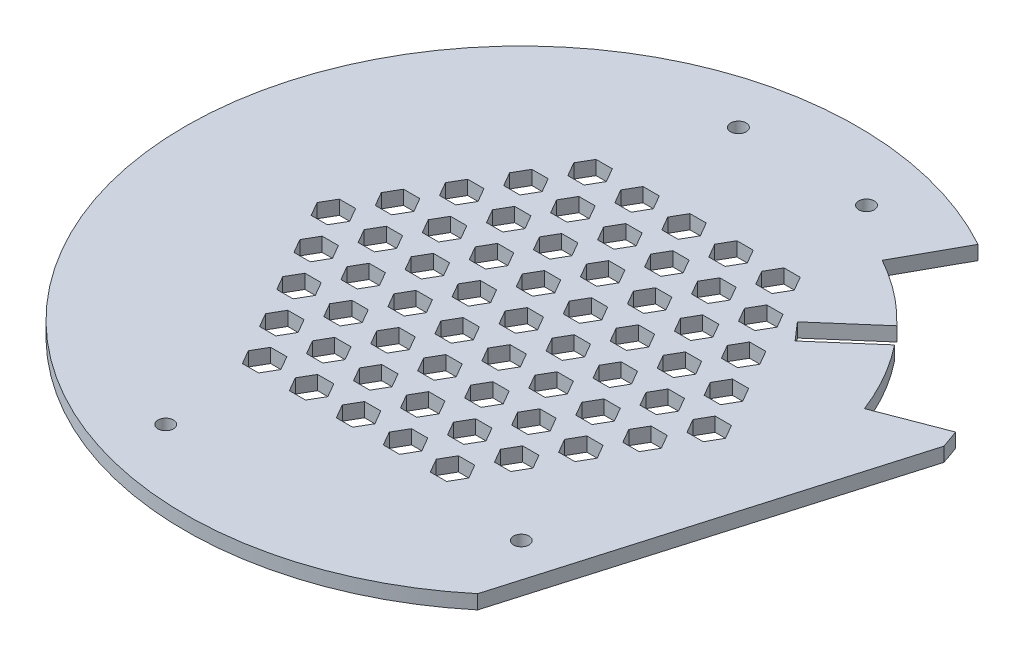
from build123d import *

# Parameters (mm, degrees)
BOSS_EXTRUDE1_DEPTH = 3
BOSS_EXTRUDE3_DEPTH = 3
CUT_EXTRUDE5_DEPTH  = 10
FILL_PATTERN1_DEPTH = 3
CUT_EXTRUDE6_DEPTH  = 102.224374782
SKETCH11_R          = 1.65
CUT_EXTRUDE7_DEPTH  = 102.224374782


# Read off the part's stored shape, not the designer's step: Fill Pattern1
with BuildPart() as part:
    # Sketch1 → Boss-Extrude1 (new body)
    with BuildSketch(Plane(origin=(0, 0, 0), x_dir=(1, 0, 0), z_dir=(0, 1, 0))):
        with BuildLine():
            Line((45.736375855, -55.017005995), (68.149505263, 21.779163377))
            ThreePointArc((68.149505263, 21.779163377), (67.498860282, 23.71899841), (66.793011614, 25.63943495))
            Line((66.793011614, 25.63943495), (46.254242231, 17.75534006))
            ThreePointArc((46.254242231, 17.75534006), (37.366545691, 32.533802239), (23.95179566, 43.370710274))
            Line((23.95179566, 43.370710274), (34.587369472, 62.629073903))
            ThreePointArc((34.587369472, 62.629073903), (-71.225880442, -6.749887428), (45.736375855, -55.017005995))
        make_face()
    extrude(amount=BOSS_EXTRUDE1_DEPTH)

    # Sketch6 → Boss-Extrude3 (add)
    with BuildSketch(Plane(origin=(0, 0, 0), x_dir=(1, 0, 0), z_dir=(0, 1, 0))):
        with BuildLine():
            ThreePointArc((23.95179566, 43.370710274), (30.151710821, 39.31388253), (35.67731642, 34.377843418))
            Line((35.67731642, 34.377843418), (40.95667498, 38.974404436))
            ThreePointArc((40.95667498, 38.974404436), (34.546931444, 44.754474127), (27.332064421, 49.491531408))
            Line((27.332064421, 49.491531408), (23.95179566, 43.370710274))
        make_face()
        with BuildLine():
            Line((46.254242231, 17.75534006), (52.782010432, 20.261115502))
            ThreePointArc((52.782010432, 20.261115502), (49.082915463, 28.059237984), (44.23993285, 35.203434037))
            Line((44.23993285, 35.203434037), (38.960574291, 30.606873018))
            ThreePointArc((38.960574291, 30.606873018), (43.08922967, 24.454556047), (46.254242231, 17.75534006))
        make_face()
    extrude(amount=BOSS_EXTRUDE3_DEPTH)

    # Sketch8 → Cut-Extrude5 (cut)
    with BuildSketch(Plane(origin=(0, 0, 0), x_dir=(1, 0, 0), z_dir=(0, 1, 0))):
        Polygon((-1.732050808, -3), (1.732050808, -3), (3.464101615, 0), (1.732050808, 3), (-1.732050808, 3), (-3.464101615, 0), align=None)
    extrude(amount=CUT_EXTRUDE5_DEPTH, mode=Mode.SUBTRACT)

    # Fill Pattern1 outline → Fill Pattern1 (cut)
    with BuildSketch(Plane(origin=(0, 0, 0), x_dir=(1, 0, 0), z_dir=(0, 1, 0))):
        Polygon((18.267949192, -3), (21.732050808, -3), (23.464101615, 0), (21.732050808, 3), (18.267949192, 3), (16.535898385, 0), align=None)
        Polygon((8.267949192, -3), (11.732050808, -3), (13.464101615, 0), (11.732050808, 3), (8.267949192, 3), (6.535898385, 0), align=None)
        Polygon((28.267949192, -3), (31.732050808, -3), (33.464101615, 0), (31.732050808, 3), (28.267949192, 3), (26.535898385, 0), align=None)
        Polygon((38.267949192, -3), (41.732050808, -3), (43.464101615, 0), (41.732050808, 3), (38.267949192, 3), (36.535898385, 0), align=None)
        Polygon((-31.732050808, -3), (-28.267949192, -3), (-26.535898385, 0), (-28.267949192, 3), (-31.732050808, 3), (-33.464101615, 0), align=None)
        Polygon((-21.732050808, -3), (-18.267949192, -3), (-16.535898385, 0), (-18.267949192, 3), (-21.732050808, 3), (-23.464101615, 0), align=None)
        Polygon((-41.732050808, -3), (-38.267949192, -3), (-36.535898385, 0), (-38.267949192, 3), (-41.732050808, 3), (-43.464101615, 0), align=None)
        Polygon((-11.732050808, -3), (-8.267949192, -3), (-6.535898385, 0), (-8.267949192, 3), (-11.732050808, 3), (-13.464101615, 0), align=None)
        Polygon((-18.267949192, -37.641016151), (-16.535898385, -34.641016151), (-18.267949192, -31.641016151), (-21.732050808, -31.641016151), (-23.464101615, -34.641016151), (-21.732050808, -37.641016151), align=None)
        Polygon((11.732050808, 14.320508076), (13.464101615, 17.320508076), (11.732050808, 20.320508076), (8.267949192, 20.320508076), (6.535898385, 17.320508076), (8.267949192, 14.320508076), align=None)
        Polygon((16.732050808, 22.980762114), (18.464101615, 25.980762114), (16.732050808, 28.980762114), (13.267949192, 28.980762114), (11.535898385, 25.980762114), (13.267949192, 22.980762114), align=None)
        Polygon((21.732050808, 31.641016151), (23.464101615, 34.641016151), (21.732050808, 37.641016151), (18.267949192, 37.641016151), (16.535898385, 34.641016151), (18.267949192, 31.641016151), align=None)
        Polygon((6.732050808, 5.660254038), (8.464101615, 8.660254038), (6.732050808, 11.660254038), (3.267949192, 11.660254038), (1.535898385, 8.660254038), (3.267949192, 5.660254038), align=None)
        Polygon((-3.267949192, -11.660254038), (-1.535898385, -8.660254038), (-3.267949192, -5.660254038), (-6.732050808, -5.660254038), (-8.464101615, -8.660254038), (-6.732050808, -11.660254038), align=None)
        Polygon((-8.267949192, -20.320508076), (-6.535898385, -17.320508076), (-8.267949192, -14.320508076), (-11.732050808, -14.320508076), (-13.464101615, -17.320508076), (-11.732050808, -20.320508076), align=None)
        Polygon((-13.267949192, -28.980762114), (-11.535898385, -25.980762114), (-13.267949192, -22.980762114), (-16.732050808, -22.980762114), (-18.464101615, -25.980762114), (-16.732050808, -28.980762114), align=None)
        Polygon((-16.535898385, 34.641016151), (-18.267949192, 37.641016151), (-21.732050808, 37.641016151), (-23.464101615, 34.641016151), (-21.732050808, 31.641016151), (-18.267949192, 31.641016151), align=None)
        Polygon((13.464101615, -17.320508076), (11.732050808, -14.320508076), (8.267949192, -14.320508076), (6.535898385, -17.320508076), (8.267949192, -20.320508076), (11.732050808, -20.320508076), align=None)
        Polygon((8.464101615, -8.660254038), (6.732050808, -5.660254038), (3.267949192, -5.660254038), (1.535898385, -8.660254038), (3.267949192, -11.660254038), (6.732050808, -11.660254038), align=None)
        Polygon((23.464101615, -34.641016151), (21.732050808, -31.641016151), (18.267949192, -31.641016151), (16.535898385, -34.641016151), (18.267949192, -37.641016151), (21.732050808, -37.641016151), align=None)
        Polygon((18.464101615, -25.980762114), (16.732050808, -22.980762114), (13.267949192, -22.980762114), (11.535898385, -25.980762114), (13.267949192, -28.980762114), (16.732050808, -28.980762114), align=None)
        Polygon((-6.535898385, 17.320508076), (-8.267949192, 20.320508076), (-11.732050808, 20.320508076), (-13.464101615, 17.320508076), (-11.732050808, 14.320508076), (-8.267949192, 14.320508076), align=None)
        Polygon((-11.535898385, 25.980762114), (-13.267949192, 28.980762114), (-16.732050808, 28.980762114), (-18.464101615, 25.980762114), (-16.732050808, 22.980762114), (-13.267949192, 22.980762114), align=None)
        Polygon((-1.535898385, 8.660254038), (-3.267949192, 11.660254038), (-6.732050808, 11.660254038), (-8.464101615, 8.660254038), (-6.732050808, 5.660254038), (-3.267949192, 5.660254038), align=None)
        Polygon((-1.732050808, 31.641016151), (1.732050808, 31.641016151), (3.464101615, 34.641016151), (1.732050808, 37.641016151), (-1.732050808, 37.641016151), (-3.464101615, 34.641016151), align=None)
        Polygon((-11.732050808, 31.641016151), (-8.267949192, 31.641016151), (-6.535898385, 34.641016151), (-8.267949192, 37.641016151), (-11.732050808, 37.641016151), (-13.464101615, 34.641016151), align=None)
        Polygon((8.267949192, 31.641016151), (11.732050808, 31.641016151), (13.464101615, 34.641016151), (11.732050808, 37.641016151), (8.267949192, 37.641016151), (6.535898385, 34.641016151), align=None)
        Polygon((-23.267949192, 22.980762114), (-21.535898385, 25.980762114), (-23.267949192, 28.980762114), (-26.732050808, 28.980762114), (-28.464101615, 25.980762114), (-26.732050808, 22.980762114), align=None)
        Polygon((-28.267949192, 14.320508076), (-26.535898385, 17.320508076), (-28.267949192, 20.320508076), (-31.732050808, 20.320508076), (-33.464101615, 17.320508076), (-31.732050808, 14.320508076), align=None)
        Polygon((-33.267949192, 5.660254038), (-31.535898385, 8.660254038), (-33.267949192, 11.660254038), (-36.732050808, 11.660254038), (-38.464101615, 8.660254038), (-36.732050808, 5.660254038), align=None)
        Polygon((26.732050808, 5.660254038), (28.464101615, 8.660254038), (26.732050808, 11.660254038), (23.267949192, 11.660254038), (21.535898385, 8.660254038), (23.267949192, 5.660254038), align=None)
        Polygon((31.732050808, 14.320508076), (33.464101615, 17.320508076), (31.732050808, 20.320508076), (28.267949192, 20.320508076), (26.535898385, 17.320508076), (28.267949192, 14.320508076), align=None)
        Polygon((16.732050808, -11.660254038), (18.464101615, -8.660254038), (16.732050808, -5.660254038), (13.267949192, -5.660254038), (11.535898385, -8.660254038), (13.267949192, -11.660254038), align=None)
        Polygon((6.732050808, -28.980762114), (8.464101615, -25.980762114), (6.732050808, -22.980762114), (3.267949192, -22.980762114), (1.535898385, -25.980762114), (3.267949192, -28.980762114), align=None)
        Polygon((1.732050808, -37.641016151), (3.464101615, -34.641016151), (1.732050808, -31.641016151), (-1.732050808, -31.641016151), (-3.464101615, -34.641016151), (-1.732050808, -37.641016151), align=None)
        Polygon((18.464101615, 8.660254038), (16.732050808, 11.660254038), (13.267949192, 11.660254038), (11.535898385, 8.660254038), (13.267949192, 5.660254038), (16.732050808, 5.660254038), align=None)
        Polygon((33.464101615, -17.320508076), (31.732050808, -14.320508076), (28.267949192, -14.320508076), (26.535898385, -17.320508076), (28.267949192, -20.320508076), (31.732050808, -20.320508076), align=None)
        Polygon((28.464101615, -8.660254038), (26.732050808, -5.660254038), (23.267949192, -5.660254038), (21.535898385, -8.660254038), (23.267949192, -11.660254038), (26.732050808, -11.660254038), align=None)
        Polygon((8.464101615, 25.980762114), (6.732050808, 28.980762114), (3.267949192, 28.980762114), (1.535898385, 25.980762114), (3.267949192, 22.980762114), (6.732050808, 22.980762114), align=None)
        Polygon((33.267949192, 5.660254038), (36.732050808, 5.660254038), (38.464101615, 8.660254038), (36.732050808, 11.660254038), (33.267949192, 11.660254038), (31.535898385, 8.660254038), align=None)
        Polygon((-16.732050808, 5.660254038), (-13.267949192, 5.660254038), (-11.535898385, 8.660254038), (-13.267949192, 11.660254038), (-16.732050808, 11.660254038), (-18.464101615, 8.660254038), align=None)
        Polygon((-26.732050808, 5.660254038), (-23.267949192, 5.660254038), (-21.535898385, 8.660254038), (-23.267949192, 11.660254038), (-26.732050808, 11.660254038), (-28.464101615, 8.660254038), align=None)
        Polygon((23.464101615, 17.320508076), (21.732050808, 20.320508076), (18.267949192, 20.320508076), (16.535898385, 17.320508076), (18.267949192, 14.320508076), (21.732050808, 14.320508076), align=None)
        Polygon((38.464101615, -8.660254038), (36.732050808, -5.660254038), (33.267949192, -5.660254038), (31.535898385, -8.660254038), (33.267949192, -11.660254038), (36.732050808, -11.660254038), align=None)
        Polygon((-21.732050808, 14.320508076), (-18.267949192, 14.320508076), (-16.535898385, 17.320508076), (-18.267949192, 20.320508076), (-21.732050808, 20.320508076), (-23.464101615, 17.320508076), align=None)
        Polygon((-1.732050808, 14.320508076), (1.732050808, 14.320508076), (3.464101615, 17.320508076), (1.732050808, 20.320508076), (-1.732050808, 20.320508076), (-3.464101615, 17.320508076), align=None)
        Polygon((28.464101615, 25.980762114), (26.732050808, 28.980762114), (23.267949192, 28.980762114), (21.535898385, 25.980762114), (23.267949192, 22.980762114), (26.732050808, 22.980762114), align=None)
        Polygon((-11.732050808, -37.641016151), (-8.267949192, -37.641016151), (-6.535898385, -34.641016151), (-8.267949192, -31.641016151), (-11.732050808, -31.641016151), (-13.464101615, -34.641016151), align=None)
        Polygon((8.267949192, -37.641016151), (11.732050808, -37.641016151), (13.464101615, -34.641016151), (11.732050808, -31.641016151), (8.267949192, -31.641016151), (6.535898385, -34.641016151), align=None)
        Polygon((1.732050808, -20.320508076), (3.464101615, -17.320508076), (1.732050808, -14.320508076), (-1.732050808, -14.320508076), (-3.464101615, -17.320508076), (-1.732050808, -20.320508076), align=None)
        Polygon((-3.267949192, -28.980762114), (-1.535898385, -25.980762114), (-3.267949192, -22.980762114), (-6.732050808, -22.980762114), (-8.464101615, -25.980762114), (-6.732050808, -28.980762114), align=None)
        Polygon((-21.535898385, -8.660254038), (-23.267949192, -5.660254038), (-26.732050808, -5.660254038), (-28.464101615, -8.660254038), (-26.732050808, -11.660254038), (-23.267949192, -11.660254038), align=None)
        Polygon((-16.535898385, -17.320508076), (-18.267949192, -14.320508076), (-21.732050808, -14.320508076), (-23.464101615, -17.320508076), (-21.732050808, -20.320508076), (-18.267949192, -20.320508076), align=None)
        Polygon((-36.732050808, -11.660254038), (-33.267949192, -11.660254038), (-31.535898385, -8.660254038), (-33.267949192, -5.660254038), (-36.732050808, -5.660254038), (-38.464101615, -8.660254038), align=None)
        Polygon((-16.732050808, -11.660254038), (-13.267949192, -11.660254038), (-11.535898385, -8.660254038), (-13.267949192, -5.660254038), (-16.732050808, -5.660254038), (-18.464101615, -8.660254038), align=None)
        Polygon((28.464101615, -25.980762114), (26.732050808, -22.980762114), (23.267949192, -22.980762114), (21.535898385, -25.980762114), (23.267949192, -28.980762114), (26.732050808, -28.980762114), align=None)
        Polygon((23.464101615, -17.320508076), (21.732050808, -14.320508076), (18.267949192, -14.320508076), (16.535898385, -17.320508076), (18.267949192, -20.320508076), (21.732050808, -20.320508076), align=None)
        Polygon((-1.535898385, 25.980762114), (-3.267949192, 28.980762114), (-6.732050808, 28.980762114), (-8.464101615, 25.980762114), (-6.732050808, 22.980762114), (-3.267949192, 22.980762114), align=None)
        Polygon((-31.732050808, -20.320508076), (-28.267949192, -20.320508076), (-26.535898385, -17.320508076), (-28.267949192, -14.320508076), (-31.732050808, -14.320508076), (-33.464101615, -17.320508076), align=None)
        Polygon((-26.732050808, -28.980762114), (-23.267949192, -28.980762114), (-21.535898385, -25.980762114), (-23.267949192, -22.980762114), (-26.732050808, -22.980762114), (-28.464101615, -25.980762114), align=None)
    extrude(amount=FILL_PATTERN1_DEPTH, mode=Mode.SUBTRACT)

    # Sketch10 → Cut-Extrude6 (cut, through all)
    with BuildSketch(Plane(origin=(0, 0, 0), x_dir=(1, 0, 0), z_dir=(0, 1, 0))):
        Polygon((40.95667498, 38.974404436), (29.643763781, 29.124630825), (32.927021651, 25.353660425), (44.23993285, 35.203434037), align=None)
    extrude(amount=CUT_EXTRUDE6_DEPTH, mode=Mode.SUBTRACT)

    # Sketch11 → Cut-Extrude7 (cut, through all)
    with BuildSketch(Plane(origin=(0, 0, 0), x_dir=(1, 0, 0), z_dir=(0, 1, 0))):
        with Locations(Location((15.529142706, 57.955549577, 0), (0, 0, 270))):
            Circle(SKETCH11_R)
        with Locations(Location((-12.474701449, 58.688856044, 0), (0, 0, 270))):
            Circle(SKETCH11_R)
        with Locations(Location((40.575649573, -40.575649573, 0), (0, 0, 270))):
            Circle(SKETCH11_R)
        with Locations(Location((-18.674701449, -57.021143956, 0), (0, 0, 270))):
            Circle(SKETCH11_R)
    extrude(amount=CUT_EXTRUDE7_DEPTH, mode=Mode.SUBTRACT)


solid = part.part
